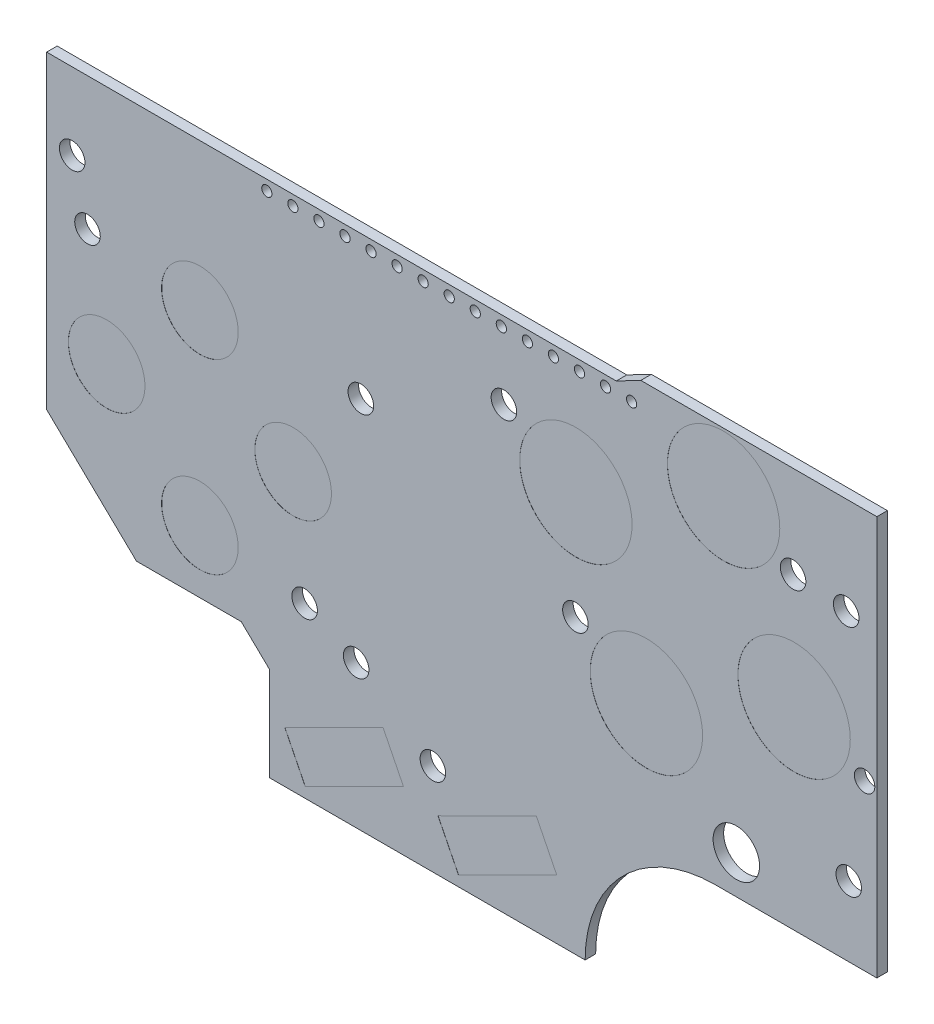
from build123d import *

# Parameters (mm, degrees)
BOSS_EXTRUDE1_DEPTH = 0.515
SKETCH6_R           = 0.5
CUT_EXTRUDE1_DEPTH  = 96.72347361
LPATTERN1_COUNT     = 15
LPATTERN1_PITCH     = 2.55
CUT_EXTRUDE17_DEPTH = 0.01
SKETCH2_R           = 5.5
CUT_EXTRUDE14_DEPTH = 0.01
SKETCH3_R           = 3.75
CUT_EXTRUDE16_DEPTH = 0.01
SKETCH8_R           = 1.25
CUT_EXTRUDE3_DEPTH  = 96.72347361
SKETCH9_R           = 1.25
CUT_EXTRUDE4_DEPTH  = 96.72347361
SKETCH10_R          = 1.25
CUT_EXTRUDE5_DEPTH  = 96.72347361
SKETCH11_R          = 1.25
CUT_EXTRUDE6_DEPTH  = 96.72347361
SKETCH12_R          = 1.25
CUT_EXTRUDE7_DEPTH  = 96.72347361
SKETCH13_R          = 1.25
CUT_EXTRUDE8_DEPTH  = 96.72347361
SKETCH14_R          = 1.25
CUT_EXTRUDE9_DEPTH  = 96.72347361
SKETCH15_R          = 1.25
CUT_EXTRUDE10_DEPTH = 96.72347361
SKETCH16_R          = 1.25
CUT_EXTRUDE11_DEPTH = 96.72347361
SKETCH17_R          = 1.25
CUT_EXTRUDE12_DEPTH = 96.72347361
SKETCH7_R           = 2.275
SKETCH7_R_2         = 1.25
CUT_EXTRUDE2_DEPTH  = 96.72347361
SKETCH18_R          = 1
CUT_EXTRUDE13_DEPTH = 96.72347361


with BuildPart() as part:
    # Sketch1 → Boss-Extrude1 (new, symmetric)
    with BuildSketch(Plane.XY):
        with BuildLine():
            Line((0, 0), (55.75, 0))
            Line((55.75, 0), (58.15, 1.25))
            Line((58.15, 1.25), (81.25, 1.25))
            Line((81.25, 1.25), (81.25, -37.85))
            Line((81.25, -37.85), (65.45, -37.85))
            ThreePointArc((65.45, -37.85), (56.43438854, -41.58438854), (52.7, -50.6))
            Line((52.7, -50.6), (21.8, -50.6))
            Line((21.8, -50.6), (21.8, -41.4))
            Line((21.8, -41.4), (19.042567568, -38.75))
            Line((19.042567568, -38.75), (8.792567568, -38.75))
            Line((8.792567568, -38.75), (0, -30.3))
            Line((0, -30.3), (0, 0))
        make_face()
    extrude(amount=BOSS_EXTRUDE1_DEPTH, both=True)

    # Sketch6 → Cut-Extrude1 (cut, through all)
    with BuildSketch(Plane.XY.offset(0.515)):
        with Locations((57.25, -1)):
            Circle(SKETCH6_R)
    cut_extrude1 = extrude(amount=-CUT_EXTRUDE1_DEPTH, mode=Mode.SUBTRACT)

    # LPattern1: Cut-Extrude1 ×15
    with Locations(*[(-i * LPATTERN1_PITCH, 0, 0) for i in range(1, LPATTERN1_COUNT)]):
        add(cut_extrude1, mode=Mode.SUBTRACT)

    # Sketch5 → Cut-Extrude17 (cut)
    with BuildSketch(Plane.XY.offset(0.515)):
        Polygon((32.918861679, -40.773499762), (23.3, -45.573499762), (25.309302326, -49.6), (34.928164005, -44.8), align=None)
        Polygon((38.3, -45.573499762), (40.309302326, -49.6), (49.928164005, -44.8), (47.918861679, -40.773499762), align=None)
    extrude(amount=-CUT_EXTRUDE17_DEPTH, mode=Mode.SUBTRACT)

    # Sketch2 → Cut-Extrude14 (cut)
    with BuildSketch(Plane.XY.offset(0.515)):
        with Locations((66.25, -4.5)):
            Circle(SKETCH2_R)
        with Locations((73.15, -18.935719587)):
            Circle(SKETCH2_R)
        with Locations((58.696235763, -25.844344587)):
            Circle(SKETCH2_R)
        with Locations((51.796235763, -11.408625)):
            Circle(SKETCH2_R)
    extrude(amount=-CUT_EXTRUDE14_DEPTH, mode=Mode.SUBTRACT)

    # Sketch3 → Cut-Extrude16 (cut)
    with BuildSketch(Plane.XY.offset(0.515)):
        with Locations((15, -14.375)):
            Circle(SKETCH3_R)
        with Locations((15, -32.625)):
            Circle(SKETCH3_R)
        with Locations((24.125, -23.5)):
            Circle(SKETCH3_R)
        with Locations((5.875, -23.5)):
            Circle(SKETCH3_R)
    extrude(amount=-CUT_EXTRUDE16_DEPTH, mode=Mode.SUBTRACT)

    # Sketch8 → Cut-Extrude3 (cut, through all)
    with BuildSketch(Plane.XY.offset(0.515)):
        with Locations((78.25, -8.25)):
            Circle(SKETCH8_R)
    extrude(amount=-CUT_EXTRUDE3_DEPTH, mode=Mode.SUBTRACT)

    # Sketch9 → Cut-Extrude4 (cut, through all)
    with BuildSketch(Plane.XY.offset(0.515)):
        with Locations((73.05, -7.75)):
            Circle(SKETCH9_R)
    extrude(amount=-CUT_EXTRUDE4_DEPTH, mode=Mode.SUBTRACT)

    # Sketch10 → Cut-Extrude5 (cut, through all)
    with BuildSketch(Plane.XY.offset(0.515)):
        with Locations((44.75, -7.5)):
            Circle(SKETCH10_R)
    extrude(amount=-CUT_EXTRUDE5_DEPTH, mode=Mode.SUBTRACT)

    # Sketch11 → Cut-Extrude6 (cut, through all)
    with BuildSketch(Plane.XY.offset(0.515)):
        with Locations((51.75, -22)):
            Circle(SKETCH11_R)
    extrude(amount=-CUT_EXTRUDE6_DEPTH, mode=Mode.SUBTRACT)

    # Sketch12 → Cut-Extrude7 (cut, through all)
    with BuildSketch(Plane.XY.offset(0.515)):
        with Locations((37.8, -41.6)):
            Circle(SKETCH12_R)
    extrude(amount=-CUT_EXTRUDE7_DEPTH, mode=Mode.SUBTRACT)

    # Sketch13 → Cut-Extrude8 (cut, through all)
    with BuildSketch(Plane.XY.offset(0.515)):
        with Locations((30.292567568, -36.6)):
            Circle(SKETCH13_R)
    extrude(amount=-CUT_EXTRUDE8_DEPTH, mode=Mode.SUBTRACT)

    # Sketch14 → Cut-Extrude9 (cut, through all)
    with BuildSketch(Plane.XY.offset(0.515)):
        with Locations((25.25, -34.1)):
            Circle(SKETCH14_R)
    extrude(amount=-CUT_EXTRUDE9_DEPTH, mode=Mode.SUBTRACT)

    # Sketch15 → Cut-Extrude10 (cut, through all)
    with BuildSketch(Plane.XY.offset(0.515)):
        with Locations((30.75, -14)):
            Circle(SKETCH15_R)
    extrude(amount=-CUT_EXTRUDE10_DEPTH, mode=Mode.SUBTRACT)

    # Sketch16 → Cut-Extrude11 (cut, through all)
    with BuildSketch(Plane.XY.offset(0.515)):
        with Locations((2.5, -7.5)):
            Circle(SKETCH16_R)
    extrude(amount=-CUT_EXTRUDE11_DEPTH, mode=Mode.SUBTRACT)

    # Sketch17 → Cut-Extrude12 (cut, through all)
    with BuildSketch(Plane.XY.offset(0.515)):
        with Locations((4, -13)):
            Circle(SKETCH17_R)
    extrude(amount=-CUT_EXTRUDE12_DEPTH, mode=Mode.SUBTRACT)

    # Sketch7 → Cut-Extrude2 (cut, through all)
    with BuildSketch(Plane.XY.offset(0.515)):
        with Locations((67.5, -34.1)):
            Circle(SKETCH7_R)
        with Locations((78.5, -31)):
            Circle(SKETCH7_R_2)
    extrude(amount=-CUT_EXTRUDE2_DEPTH, mode=Mode.SUBTRACT)

    # Sketch18 → Cut-Extrude13 (cut, through all)
    with BuildSketch(Plane.XY.offset(0.515)):
        with Locations((80.05, -21.75)):
            Circle(SKETCH18_R)
    extrude(amount=-CUT_EXTRUDE13_DEPTH, mode=Mode.SUBTRACT)


solid = part.part
